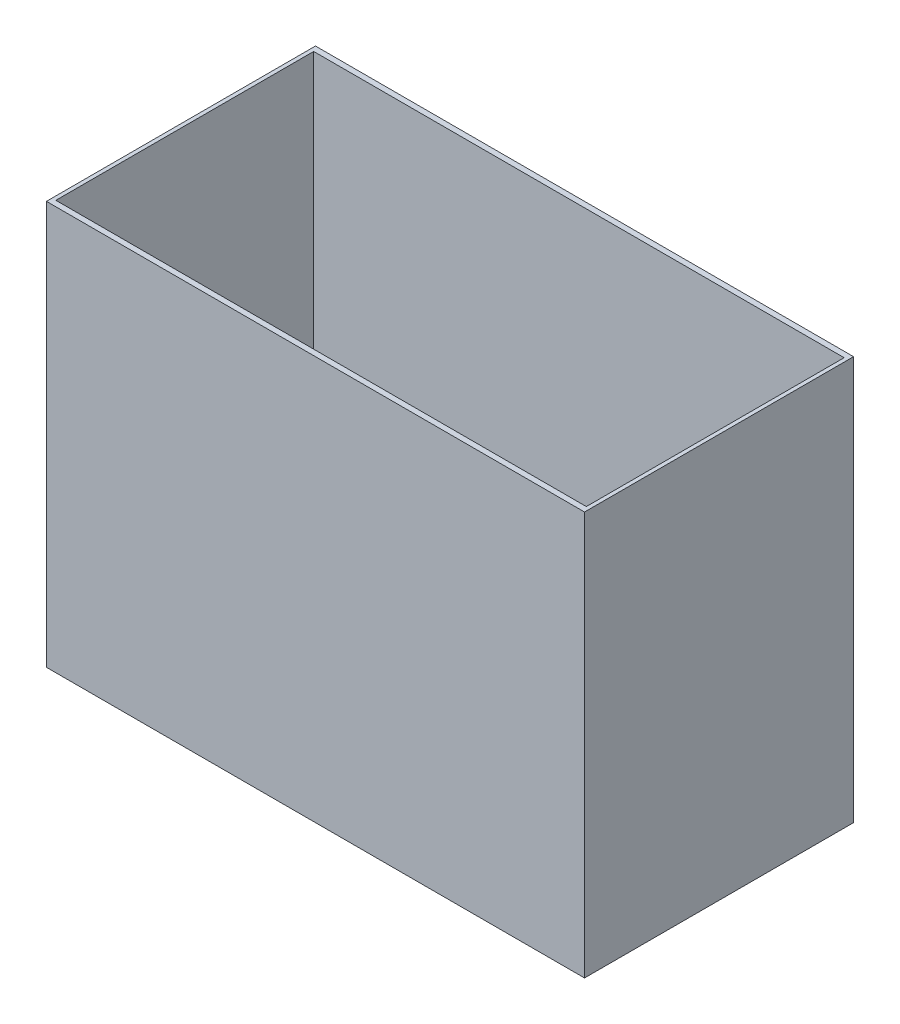
from build123d import *

# Parameters (mm, degrees)
SKETCH1_W           = 584.2
SKETCH1_H           = 279.4
BOSS_EXTRUDE1_DEPTH = 6.35
SKETCH3_W           = 609.6
SKETCH3_H           = 304.8
SKETCH3_W_2         = 600.964
SKETCH3_H_2         = 292.1
BOSS_EXTRUDE3_DEPTH = 457.2
SKETCH4_R           = 21.038100037
CUT_EXTRUDE1_DEPTH  = 566.15
SKETCH11_W          = 50.8
SKETCH11_H          = 3.175
CUT_EXTRUDE6_DEPTH  = 571.228585744
SKETCH12_W          = 6.35
SKETCH12_H          = 25.4
CUT_EXTRUDE7_DEPTH  = 566.15
SKETCH13_R          = 21.038100037
CUT_EXTRUDE8_DEPTH  = 566.15
SKETCH14_R          = 2.778125
CUT_EXTRUDE9_DEPTH  = 566.15
SKETCH15_W          = 6.604
SKETCH15_H          = 19.304
SKETCH15_H_2        = 25.654
CUT_EXTRUDE10_DEPTH = 571.228585744
SKETCH16_W          = 25.4
SKETCH16_H          = 12.7
CUT_EXTRUDE11_DEPTH = 571.228585744


with BuildPart() as part:
    # Sketch1 → Boss-Extrude1 (new body)
    with BuildSketch(Plane(origin=(0, 0, 0), x_dir=(1, 0, 0), z_dir=(0, 1, 0))):
        Rectangle(SKETCH1_W, SKETCH1_H)
    extrude(amount=BOSS_EXTRUDE1_DEPTH)

    # Sketch4 → Cut-Extrude1 (cut, through all)
    with BuildSketch(Plane(origin=(0, 6.35, 0), x_dir=(1, 0, 0), z_dir=(0, 1, 0))):
        with Locations((252.011899963, 99.611899963)):
            Circle(SKETCH4_R)
    cut_extrude1 = extrude(amount=-CUT_EXTRUDE1_DEPTH, mode=Mode.SUBTRACT)

    # Sketch11 → Cut-Extrude6 (cut, through all)
    with BuildSketch(Plane.XZ):
        with Locations((190.5, 138.1125)):
            Rectangle(SKETCH11_W, SKETCH11_H)
    cut_extrude6 = extrude(amount=-CUT_EXTRUDE6_DEPTH, mode=Mode.SUBTRACT)

    # Mirror2: Cut-Extrude1, Cut-Extrude6 across plane
    add(cut_extrude1.mirror(Plane.XY), mode=Mode.SUBTRACT)
    add(cut_extrude6.mirror(Plane.XY), mode=Mode.SUBTRACT)

    # Sketch12 → Cut-Extrude7 (cut, through all)
    with BuildSketch(Plane(origin=(0, 6.35, 0), x_dir=(1, 0, 0), z_dir=(0, 1, 0))):
        with Locations((288.925, -30.48)):
            Rectangle(SKETCH12_W, SKETCH12_H)
        with Locations((288.925, -91.44)):
            Rectangle(SKETCH12_W, SKETCH12_H)
        with Locations((288.925, 91.44)):
            Rectangle(SKETCH12_W, SKETCH12_H)
        with Locations((288.925, 30.48)):
            Rectangle(SKETCH12_W, SKETCH12_H)
    extrude(amount=-CUT_EXTRUDE7_DEPTH, mode=Mode.SUBTRACT)

    # Sketch13 → Cut-Extrude8 (cut, through all)
    with BuildSketch(Plane(origin=(0, 6.35, 0), x_dir=(1, 0, 0), z_dir=(0, 1, 0))):
        with Locations((133.500264321, -46.186585501)):
            Circle(SKETCH13_R)
        with Locations((210.617612829, 12.193993268)):
            Circle(SKETCH13_R)
    extrude(amount=-CUT_EXTRUDE8_DEPTH, mode=Mode.SUBTRACT)

    # Sketch14 → Cut-Extrude9 (cut, through all)
    with BuildSketch(Plane(origin=(0, 6.35, 0), x_dir=(1, 0, 0), z_dir=(0, 1, 0))):
        with Locations((45.303543088, 4.218995635)):
            Circle(SKETCH14_R)
    extrude(amount=-CUT_EXTRUDE9_DEPTH, mode=Mode.SUBTRACT)

    # Sketch15 → Cut-Extrude10 (cut, through all)
    with BuildSketch(Plane.XZ):
        with Locations((92.075, -47.625)):
            Rectangle(SKETCH15_W, SKETCH15_H)
        with Locations((92.075, 44.45)):
            Rectangle(SKETCH15_W, SKETCH15_H_2)
    extrude(amount=-CUT_EXTRUDE10_DEPTH, mode=Mode.SUBTRACT)

    # Sketch16 → Cut-Extrude11 (cut, through all)
    with BuildSketch(Plane.XZ):
        with Locations((-50.8, -60.325)):
            Rectangle(SKETCH16_W, SKETCH16_H)
        with Locations((-228.6, -60.325)):
            Rectangle(SKETCH16_W, SKETCH16_H)
        with Locations((-228.6, 60.325)):
            Rectangle(SKETCH16_W, SKETCH16_H)
        with Locations((-50.8, 60.325)):
            Rectangle(SKETCH16_W, SKETCH16_H)
    extrude(amount=-CUT_EXTRUDE11_DEPTH, mode=Mode.SUBTRACT)


with BuildPart() as body_2:
    # Sketch3 → Boss-Extrude3 (new body)
    with BuildSketch(Plane(origin=(0, 0, 0), x_dir=(1, 0, 0), z_dir=(0, 1, 0))):
        Rectangle(SKETCH3_W, SKETCH3_H)
        Rectangle(SKETCH3_W_2, SKETCH3_H_2, mode=Mode.SUBTRACT)
    extrude(amount=BOSS_EXTRUDE3_DEPTH)


solid = Compound([part.part, body_2.part])
